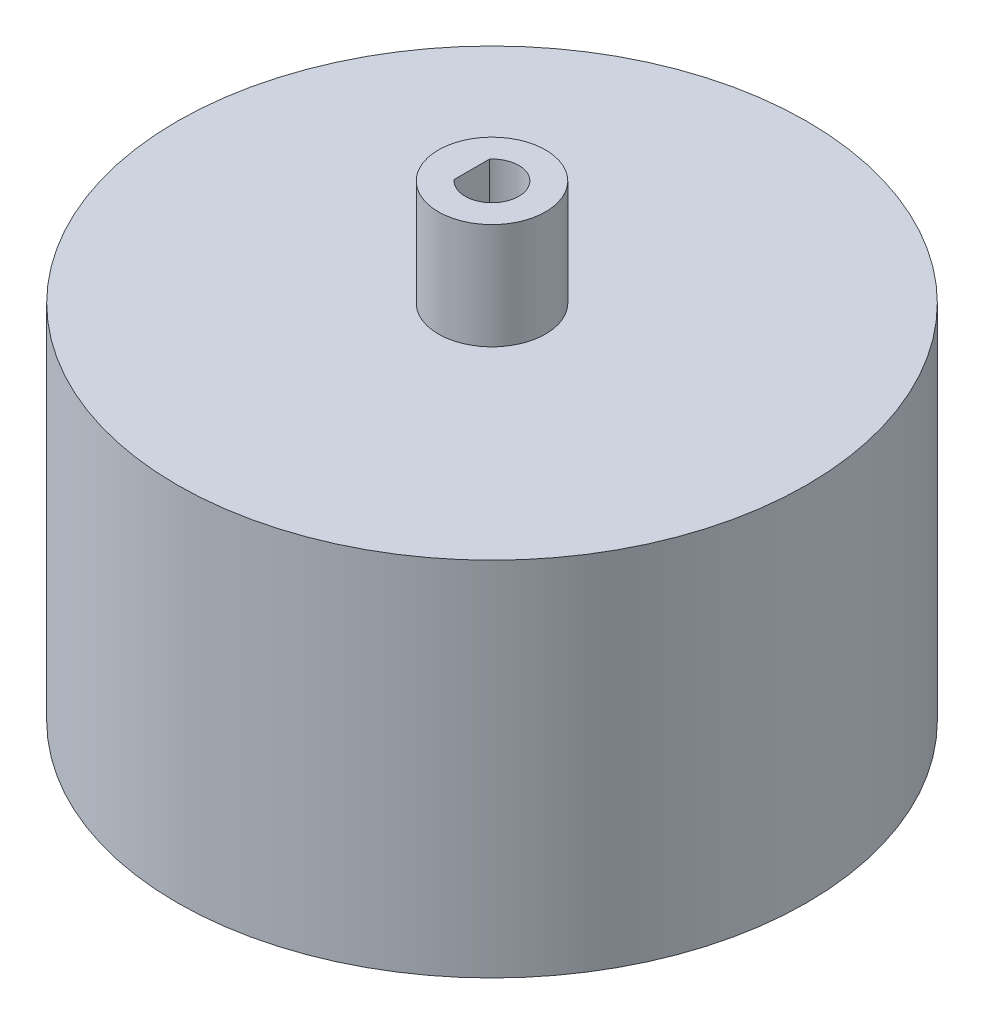
from build123d import *

# Parameters (mm, degrees)
CROQUIS1_R              = 23.5
CROQUIS1_R_2            = 19.5
SALIENTE_EXTRUIR1_DEPTH = 22
CROQUIS2_R              = 23.5
SALIENTE_EXTRUIR2_DEPTH = 5
CROQUIS4_R              = 4
SALIENTE_EXTRUIR3_DEPTH = 7.9
CORTAR_EXTRUIR1_DEPTH   = 49.192426791
ENVOLVER5_DEPTH         = 17


# Read off the part's stored shape, not the designer's step: Envolver5
with BuildPart() as part:
    # Croquis1 → Saliente-Extruir1 (new body)
    with BuildSketch(Plane(origin=(0, 0, 0), x_dir=(1, 0, 0), z_dir=(0, 1, 0))):
        with Locations(Location((0, 0, 0), (0, 0, 270))):
            Circle(CROQUIS1_R)
        with Locations(Location((0, 0, 0), (0, 0, 270))):
            Circle(CROQUIS1_R_2, mode=Mode.SUBTRACT)
    extrude(amount=SALIENTE_EXTRUIR1_DEPTH)

    # Croquis2 → Saliente-Extruir2 (add)
    with BuildSketch(Plane(origin=(0, 22, 0), x_dir=(1, 0, 0), z_dir=(0, 1, 0))):
        with Locations(Location((0, 0, 0), (0, 0, 270))):
            Circle(CROQUIS2_R)
    extrude(amount=SALIENTE_EXTRUIR2_DEPTH)

    # Croquis4 → Saliente-Extruir3 (add)
    with BuildSketch(Plane(origin=(0, 27, 0), x_dir=(1, 0, 0), z_dir=(0, 1, 0))):
        with Locations(Location((0, 0, 0), (0, 0, 270))):
            Circle(CROQUIS4_R)
    extrude(amount=SALIENTE_EXTRUIR3_DEPTH)

    # Croquis5 → Cortar-Extruir1 (cut, through all)
    with BuildSketch(Plane(origin=(0, 34.9, 0), x_dir=(1, 0, 0), z_dir=(0, 1, 0))):
        with BuildLine():
            Line((-1.5, 1.322875656), (-1.5, -1.322875656))
            ThreePointArc((-1.5, -1.322875656), (2, 0), (-1.5, 1.322875656))
        make_face()
    extrude(amount=-CORTAR_EXTRUIR1_DEPTH, mode=Mode.SUBTRACT)

    # Envolver5 outline → Envolver5 (add)
    with BuildSketch(Plane(origin=(0, 0, 0), x_dir=(1, 0, 0), z_dir=(0, 1, 0))):
        with BuildLine():
            ThreePointArc((-18.034428092, -7.416832437), (-17.731299823, -8.114863313), (-17.401166174, -8.800534972))
            Line((-17.401166174, -8.800534972), (-16.508798678, -8.349225486))
            ThreePointArc((-16.508798678, -8.349225486), (-16.822002396, -7.698716476), (-17.109585626, -7.036482056))
            Line((-17.109585626, -7.036482056), (-18.034428092, -7.416832437))
        make_face()
        with BuildLine():
            Line((-16.299247399, -8.751259009), (-17.180287799, -9.224300036))
            ThreePointArc((-17.180287799, -9.224300036), (-16.807285038, -9.887627099), (-16.408684204, -10.535894964))
            Line((-16.408684204, -10.535894964), (-15.567213219, -9.995592659))
            ThreePointArc((-15.567213219, -9.995592659), (-15.945372985, -9.380569299), (-16.299247399, -8.751259009))
        make_face()
        with BuildLine():
            ThreePointArc((-18.699023356, -5.531412617), (-18.55106119, -6.00900397), (-18.390903072, -6.482644847))
            Line((-18.390903072, -6.482644847), (-17.447779837, -6.150201521))
            ThreePointArc((-17.447779837, -6.150201521), (-17.599724719, -5.70084992), (-17.740099081, -5.247750431))
            Line((-17.740099081, -5.247750431), (-18.699023356, -5.531412617))
        make_face()
        with BuildLine():
            Line((-15.317601198, -10.374058682), (-16.145579641, -10.934818611))
            ThreePointArc((-16.145579641, -10.934818611), (-15.706622714, -11.556470175), (-15.24374406, -12.160520837))
            Line((-15.24374406, -12.160520837), (-14.462013596, -11.536904384))
            ThreePointArc((-14.462013596, -11.536904384), (-14.901154883, -10.963830679), (-15.317601198, -10.374058682))
        make_face()
        with BuildLine():
            ThreePointArc((-19.256272079, -3.073432222), (-19.12168694, -3.822445367), (-18.957978812, -4.565636795))
            Line((-18.957978812, -4.565636795), (-17.985774771, -4.331501575))
            ThreePointArc((-17.985774771, -4.331501575), (-18.141087609, -3.626422527), (-18.268770947, -2.915820313))
            Line((-18.268770947, -2.915820313), (-19.256272079, -3.073432222))
        make_face()
        with BuildLine():
            Line((-14.174964299, -11.887825163), (-14.941178586, -12.530410307))
            ThreePointArc((-14.941178586, -12.530410307), (-14.440881008, -13.103852705), (-13.91858947, -13.657337485))
            Line((-13.91858947, -13.657337485), (-13.204815651, -12.956961203))
            ThreePointArc((-13.204815651, -12.956961203), (-13.700323007, -12.431860259), (-14.174964299, -11.887825163))
        make_face()
        with BuildLine():
            ThreePointArc((-19.469750114, -1.085739617), (-19.412559476, -1.844596047), (-19.325802842, -2.600643094))
            Line((-19.325802842, -2.600643094), (-18.33473603, -2.467276781))
            ThreePointArc((-18.33473603, -2.467276781), (-18.417043606, -1.750001378), (-18.47130139, -1.030060662))
            Line((-18.47130139, -1.030060662), (-19.469750114, -1.085739617))
        make_face()
        with BuildLine():
            Line((-12.883346018, -13.276648499), (-13.5797431, -13.994305175))
            ThreePointArc((-13.5797431, -13.994305175), (-13.023363087, -14.513511426), (-12.447148042, -15.010613099))
            Line((-12.447148042, -15.010613099), (-11.808832758, -14.240838068))
            ThreePointArc((-11.808832758, -14.240838068), (-12.355498313, -13.769228789), (-12.883346018, -13.276648499))
        make_face()
        with BuildLine():
            ThreePointArc((-19.47859763, 0.913364304), (-19.499402579, 0.152640304), (-19.490509266, -0.608316173))
            Line((-19.490509266, -0.608316173), (-18.49099597, -0.577120472))
            ThreePointArc((-18.49099597, -0.577120472), (-18.499433216, 0.144812596), (-18.479695188, 0.866525109))
            Line((-18.479695188, 0.866525109), (-19.47859763, 0.913364304))
        make_face()
        with BuildLine():
            Line((-11.456321492, -14.525931911), (-12.075582113, -15.31111742))
            ThreePointArc((-12.075582113, -15.31111742), (-11.468967316, -15.770630574), (-10.844884887, -16.206124515))
            Line((-10.844884887, -16.206124515), (-10.288736944, -15.375041206))
            ThreePointArc((-10.288736944, -15.375041206), (-10.880815146, -14.961880288), (-11.456321492, -14.525931911))
        make_face()
        with BuildLine():
            ThreePointArc((-19.282721641, 2.902868604), (-19.381303511, 2.148272377), (-19.450366989, 1.390404258))
            Line((-19.450366989, 1.390404258), (-18.452912271, 1.319101475))
            ThreePointArc((-18.452912271, 1.319101475), (-18.387390511, 2.038104563), (-18.29386412, 2.754003548))
            Line((-18.29386412, 2.754003548), (-19.282721641, 2.902868604))
        make_face()
        with BuildLine():
            Line((-9.908888999, -15.622545209), (-10.444504621, -16.467007112))
            ThreePointArc((-10.444504621, -16.467007112), (-9.79403067, -16.861997605), (-9.128640073, -17.231306695))
            Line((-9.128640073, -17.231306695), (-8.660504684, -16.347649942))
            ThreePointArc((-8.660504684, -16.347649942), (-9.291772686, -15.997279779), (-9.908888999, -15.622545209))
        make_face()
        with BuildLine():
            ThreePointArc((-18.884180835, 4.861863242), (-19.059503515, 4.121325729), (-19.205797914, 3.374511294))
            Line((-19.205797914, 3.374511294), (-18.220885201, 3.201459433))
            ThreePointArc((-18.220885201, 3.201459433), (-18.082093078, 3.909975691), (-17.915761305, 4.612536922))
            Line((-17.915761305, 4.612536922), (-18.884180835, 4.861863242))
        make_face()
        with BuildLine():
            Line((-8.257312331, -16.554962793), (-8.703653538, -17.449825646))
            ThreePointArc((-8.703653538, -17.449825646), (-8.016157029, -17.776142058), (-7.316451637, -18.075384794))
            Line((-7.316451637, -18.075384794), (-6.941248989, -17.148441984))
            ThreePointArc((-6.941248989, -17.148441984), (-7.605072053, -16.86454503), (-8.257312331, -16.554962793))
        make_face()
        with BuildLine():
            ThreePointArc((-18.287163949, 6.769758837), (-18.537384765, 6.051063217), (-18.759372506, 5.32315162))
            Line((-18.759372506, 5.32315162), (-17.797353403, 5.050169486))
            ThreePointArc((-17.797353403, 5.050169486), (-17.586749649, 5.740752283), (-17.349360669, 6.422591717))
            Line((-17.349360669, 6.422591717), (-18.287163949, 6.769758837))
        make_face()
        with BuildLine():
            Line((-6.51894985, -17.313384789), (-6.871325517, -18.249243426))
            ThreePointArc((-6.871325517, -18.249243426), (-6.15403216, -18.503456114), (-5.427366, -18.729487401))
            Line((-5.427366, -18.729487401), (-5.149039538, -17.769000868))
            ThreePointArc((-5.149039538, -17.769000868), (-5.838440767, -17.554560929), (-6.51894985, -17.313384789))
        make_face()
        with BuildLine():
            ThreePointArc((-17.497945734, 8.606503069), (-17.820434823, 7.917202961), (-18.115782775, 7.215844681))
            Line((-18.115782775, 7.215844681), (-17.186768274, 6.845801364))
            ThreePointArc((-17.186768274, 6.845801364), (-16.90656637, 7.511192553), (-16.600615184, 8.165143938))
            Line((-16.600615184, 8.165143938), (-17.497945734, 8.606503069))
        make_face()
        with BuildLine():
            Line((-4.712072052, -17.889840049), (-4.966778649, -18.85685843))
            ThreePointArc((-4.966778649, -18.85685843), (-4.227227324, -19.036295573), (-3.481237786, -19.186739782))
            Line((-3.481237786, -19.186739782), (-3.302712772, -18.202804409))
            ThreePointArc((-3.302712772, -18.202804409), (-4.010446436, -18.060075287), (-4.712072052, -17.889840049))
        make_face()
        with BuildLine():
            ThreePointArc((-16.524821015, 10.352791432), (-16.916188958, 9.700131502), (-17.281792962, 9.032697937))
            Line((-17.281792962, 9.032697937), (-16.395547169, 8.569482659))
            ThreePointArc((-16.395547169, 8.569482659), (-16.048692088, 9.202688861), (-15.677394296, 9.821879051))
            Line((-15.677394296, 9.821879051), (-16.524821015, 10.352791432))
        make_face()
        with BuildLine():
            Line((-2.855669543, -18.278269925), (-3.010030059, -19.266284516))
            ThreePointArc((-3.010030059, -19.266284516), (-2.255993581, -19.369060198), (-1.498521148, -19.442336135))
            Line((-1.498521148, -19.442336135), (-1.421673909, -18.445293256))
            ThreePointArc((-1.421673909, -18.445293256), (-2.140301603, -18.37577506), (-2.855669543, -18.278269925))
        make_face()
        with BuildLine():
            ThreePointArc((-15.378017503, 11.990270125), (-15.834150954, 11.381109944), (-16.266168448, 10.754615941))
            Line((-16.266168448, 10.754615941), (-15.432005963, 10.203097175))
            ThreePointArc((-15.432005963, 10.203097175), (-15.022143213, 10.79746328), (-14.589401221, 11.375384477))
            Line((-14.589401221, 11.375384477), (-15.378017503, 11.990270125))
        make_face()
        with BuildLine():
            Line((-0.969253443, -18.474591951), (-1.021645521, -19.473218543))
            ThreePointArc((-1.021645521, -19.473218543), (-0.261048947, -19.498252574), (0.499945213, -19.493590095))
            Line((0.499945213, -19.493590095), (0.474306997, -18.493918808))
            ThreePointArc((0.474306997, -18.493918808), (-0.247661822, -18.498342186), (-0.969253443, -18.474591951))
        make_face()
        with BuildLine():
            ThreePointArc((-14.069588308, 13.501728958), (-14.585693224, 12.942470907), (-15.079583626, 12.363501028))
            Line((-15.079583626, 12.363501028), (-14.306271645, 11.729475335))
            ThreePointArc((-14.306271645, 11.729475335), (-13.837708955, 12.278754451), (-13.348070959, 12.809332601))
            Line((-13.348070959, 12.809332601), (-14.069588308, 13.501728958))
        make_face()
        with BuildLine():
            Line((0.927349683, -18.476742748), (0.977476693, -19.475485599))
            ThreePointArc((0.977476693, -19.475485599), (1.736639358, -19.422514866), (2.493157062, -19.339962975))
            Line((2.493157062, -19.339962975), (2.365302853, -18.348170002))
            ThreePointArc((2.365302853, -18.348170002), (1.647580929, -18.426488463), (0.927349683, -18.476742748))
        make_face()
        with BuildLine():
            ThreePointArc((-12.61328525, 14.871282231), (-13.183937276, 14.367804213), (-13.734509712, 13.842443533))
            Line((-13.734509712, 13.842443533), (-13.030175881, 13.132574634))
            ThreePointArc((-13.030175881, 13.132574634), (-12.507837929, 13.63099374), (-11.966450109, 14.108652373))
            Line((-11.966450109, 14.108652373), (-12.61328525, 14.871282231))
        make_face()
        with BuildLine():
            Line((2.814206199, -18.28469971), (2.966325453, -19.273061856))
            ThreePointArc((2.966325453, -19.273061856), (3.716075276, -19.142643092), (4.460165388, -18.983069423))
            Line((4.460165388, -18.983069423), (4.231438958, -18.009578683))
            ThreePointArc((4.231438958, -18.009578683), (3.525507313, -18.160969087), (2.814206199, -18.28469971))
        make_face()
        with BuildLine():
            ThreePointArc((-11.024414333, 16.084535698), (-11.643615817, 15.642129354), (-12.245083672, 15.175899507))
            Line((-12.245083672, 15.175899507), (-11.617130664, 14.397648251))
            ThreePointArc((-11.617130664, 14.397648251), (-11.046507313, 14.839968874), (-10.459059752, 15.259687713))
            Line((-10.459059752, 15.259687713), (-11.024414333, 16.084535698))
        make_face()
        with BuildLine():
            Line((4.671484911, -17.900481243), (4.923997609, -18.868074824))
            ThreePointArc((4.923997609, -18.868074824), (5.656454586, -18.661578752), (6.380296588, -18.426660453))
            Line((6.380296588, -18.426660453), (6.053101891, -17.481703507))
            ThreePointArc((6.053101891, -17.481703507), (5.366379992, -17.704574714), (4.671484911, -17.900481243))
        make_face()
        with BuildLine():
            ThreePointArc((-9.319674872, 17.128737849), (-9.980917895, 16.752052948), (-10.626959637, 16.349854093))
            Line((-10.626959637, 16.349854093), (-10.081987348, 15.511400037))
            ThreePointArc((-10.081987348, 15.511400037), (-9.469075952, 15.89297331), (-8.841742827, 16.250341036))
            Line((-8.841742827, 16.250341036), (-9.319674872, 17.128737849))
        make_face()
        with BuildLine():
            Line((6.479665489, -17.328125552), (6.829917678, -18.264780987))
            ThreePointArc((6.829917678, -18.264780987), (7.537383557, -17.984377919), (8.233369741, -17.676584023))
            Line((8.233369741, -17.676584023), (7.811145652, -16.770092534))
            ThreePointArc((7.811145652, -16.770092534), (7.150851067, -17.062102128), (6.479665489, -17.328125552))
        make_face()
        with BuildLine():
            ThreePointArc((-7.516983978, 17.992913935), (-8.213318761, 17.685909503), (-8.897144376, 17.351968821))
            Line((-8.897144376, 17.351968821), (-8.440880562, 16.462124266))
            ThreePointArc((-8.440880562, 16.462124266), (-7.792122927, 16.778939784), (-7.13149762, 17.0702004))
            Line((-7.13149762, 17.0702004), (-7.516983978, 17.992913935))
        make_face()
        with BuildLine():
            Line((8.219743638, -16.573648196), (8.664054105, -17.469521072))
            ThreePointArc((8.664054105, -17.469521072), (9.339093294, -17.118158092), (9.999908722, -16.740723567))
            Line((9.999908722, -16.740723567), (9.48709289, -15.882224923))
            ThreePointArc((9.48709289, -15.882224923), (8.860165432, -16.24030383), (8.219743638, -16.573648196))
        make_face()
        with BuildLine():
            ThreePointArc((-5.635288254, 18.667981313), (-6.359396194, 18.43388402), (-7.073818554, 18.171711286))
            Line((-7.073818554, 18.171711286), (-6.711058628, 17.239828656))
            ThreePointArc((-6.711058628, 17.239828656), (-6.033273312, 17.488556634), (-5.346299113, 17.710648938))
            Line((-5.346299113, 17.710648938), (-5.635288254, 18.667981313))
        make_face()
        with BuildLine():
            Line((9.873430826, -15.644978866), (10.40712979, -16.490653399))
            ThreePointArc((10.40712979, -16.490653399), (11.042647508, -16.072023395), (11.661346894, -15.628915145))
            Line((11.661346894, -15.628915145), (11.063329104, -14.827432317))
            ThreePointArc((11.063329104, -14.827432317), (10.476357892, -15.247817067), (9.873430826, -15.644978866))
        make_face()
        with BuildLine():
            ThreePointArc((-3.694364653, 19.146844905), (-4.438635247, 18.988115155), (-5.176145647, 18.800465852))
            Line((-5.176145647, 18.800465852), (-4.91070228, 17.836339398))
            ThreePointArc((-4.91070228, 17.836339398), (-4.211012926, 18.01436566), (-3.504910055, 18.164955423))
            Line((-3.504910055, 18.164955423), (-3.694364653, 19.146844905))
        make_face()
        with BuildLine():
            Line((11.42334651, -14.551878041), (12.0408247, -15.338466043))
            ThreePointArc((12.0408247, -15.338466043), (12.630141544, -14.85696889), (13.200222247, -14.352844061))
            Line((13.200222247, -14.352844061), (12.523287773, -13.616800776))
            ThreePointArc((12.523287773, -13.616800776), (11.982441977, -14.095073049), (11.42334651, -14.551878041))
        make_face()
        with BuildLine():
            ThreePointArc((-1.714612626, 19.42447177), (-2.471223459, 19.342777841), (-3.224070534, 19.231624195))
            Line((-3.224070534, 19.231624195), (-3.058733583, 18.245387057))
            ThreePointArc((-3.058733583, 18.245387057), (-2.344494051, 18.350840516), (-1.626683773, 18.428345013))
            Line((-1.626683773, 18.428345013), (-1.714612626, 19.42447177))
        make_face()
        with BuildLine():
            Line((12.853200802, -13.305834403), (13.547968413, -14.025068695))
            ThreePointArc((13.547968413, -14.025068695), (14.084890558, -13.485765013), (14.600360929, -12.925922046))
            Line((14.600360929, -12.925922046), (13.851624471, -12.263054249))
            ThreePointArc((13.851624471, -12.263054249), (13.362588478, -12.79418732), (12.853200802, -13.305834403))
        make_face()
        with BuildLine():
            ThreePointArc((0.283160283, 19.497944001), (-0.477838675, 19.494144511), (-1.238109869, 19.460654767))
            Line((-1.238109869, 19.460654767), (-1.174617055, 18.462672471))
            ThreePointArc((-1.174617055, 18.462672471), (-0.453334128, 18.494444792), (0.268639243, 18.498049437))
            Line((0.268639243, 18.498049437), (0.283160283, 19.497944001))
        make_face()
        with BuildLine():
            Line((14.147965679, -11.919944091), (14.912720581, -12.564265394))
            ThreePointArc((14.912720581, -12.564265394), (15.39160488, -11.97282336), (15.847047235, -11.363146305))
            Line((15.847047235, -11.363146305), (15.034378146, -10.780420853))
            ThreePointArc((15.034378146, -10.780420853), (14.602291809, -11.358832419), (14.147965679, -11.919944091))
        make_face()
        with BuildLine():
            ThreePointArc((2.277957127, 19.366489391), (1.520568277, 19.440624273), (0.760863549, 19.485150414))
            Line((0.760863549, 19.485150414), (0.721844906, 18.485911931))
            ThreePointArc((0.721844906, 18.485911931), (1.442590417, 18.443669182), (2.161138813, 18.373336089))
            Line((2.161138813, 18.373336089), (2.277957127, 19.366489391))
        make_face()
        with BuildLine():
            Line((15.294032934, -10.408773059), (16.120737417, -10.971409441))
            ThreePointArc((16.120737417, -10.971409441), (16.536550712, -10.334045217), (16.927178271, -9.680941885))
            Line((16.927178271, -9.680941885), (16.059117847, -9.184483327))
            ThreePointArc((16.059117847, -9.184483327), (15.688522471, -9.80409418), (15.294032934, -10.408773059))
        make_face()
        with BuildLine():
            ThreePointArc((4.248812239, 19.031489552), (3.502993788, 19.182779635), (2.751840157, 19.304853684))
            Line((2.751840157, 19.304853684), (2.610720149, 18.314861187))
            ThreePointArc((2.610720149, 18.314861187), (3.323353081, 18.199047346), (4.030924432, 18.055515729))
            Line((4.030924432, 18.055515729), (4.248812239, 19.031489552))
        make_face()
        with BuildLine():
            Line((16.279357198, -8.788203981), (17.159322452, -9.263242034))
            ThreePointArc((17.159322452, -9.263242034), (17.507694472, -8.586654429), (17.829401669, -7.896989054))
            Line((17.829401669, -7.896989054), (16.915073378, -7.492015256))
            ThreePointArc((16.915073378, -7.492015256), (16.609863986, -8.146313177), (16.279357198, -8.788203981))
        make_face()
        with BuildLine():
            ThreePointArc((6.175011583, 18.496465391), (5.448602215, 18.72332059), (4.713894438, 18.921659526))
            Line((4.713894438, 18.921659526), (4.472156262, 17.951318012))
            ThreePointArc((4.472156262, 17.951318012), (5.169186717, 17.763150303), (5.858344322, 17.547928704))
            Line((5.858344322, 17.547928704), (6.175011583, 18.496465391))
        make_face()
        with BuildLine():
            Line((17.093582538, -7.075269324), (18.017559973, -7.457716315))
            ThreePointArc((18.017559973, -7.457716315), (18.294829265, -6.749016385), (18.544234902, -6.030037471))
            Line((18.544234902, -6.030037471), (17.593248497, -5.72080478))
            ThreePointArc((17.593248497, -5.72080478), (17.356632892, -6.40291298), (17.093582538, -7.075269324))
        make_face()
        with BuildLine():
            ThreePointArc((8.036310462, 17.767040107), (7.336944868, 18.067076133), (6.626404855, 18.33959538))
            Line((6.626404855, 18.33959538), (6.286589221, 17.399103309))
            ThreePointArc((6.286589221, 17.399103309), (6.960691285, 17.140559408), (7.624191977, 16.855909845))
            Line((7.624191977, 16.855909845), (8.036310462, 17.767040107))
        make_face()
        with BuildLine():
            Line((17.728151302, -5.287972336), (18.686429751, -5.573808678))
            ThreePointArc((18.686429751, -5.573808678), (18.889682166, -4.840444985), (19.064164946, -4.099709127))
            Line((19.064164946, -4.099709127), (18.086515461, -3.889467634))
            ThreePointArc((18.086515461, -3.889467634), (17.920980517, -4.592217037), (17.728151302, -5.287972336))
        make_face()
        with BuildLine():
            ThreePointArc((9.813146297, 16.850880088), (9.148174933, 17.22094351), (8.469270584, 17.564778842))
            Line((8.469270584, 17.564778842), (8.034949016, 16.664020953))
            ThreePointArc((8.034949016, 16.664020953), (8.679037758, 16.337818202), (9.309908026, 15.986732391))
            Line((9.309908026, 15.986732391), (9.813146297, 16.850880088))
        make_face()
        with BuildLine():
            Line((18.176394059, -3.445097822), (19.158901846, -3.631319326))
            ThreePointArc((19.158901846, -3.631319326), (19.286001167, -2.880999652), (19.383727243, -2.126292116))
            Line((19.383727243, -2.126292116), (18.389689949, -2.017251494))
            ThreePointArc((18.389689949, -2.017251494), (18.296975466, -2.73325608), (18.176394059, -3.445097822))
        make_face()
        with BuildLine():
            ThreePointArc((11.486844229, 15.757614339), (10.863256062, 16.193815725), (10.223122782, 16.605353371))
            Line((10.223122782, 16.605353371), (9.698860075, 15.753796788))
            ThreePointArc((9.698860075, 15.753796788), (10.306166007, 15.363363636), (10.897775294, 14.949531553))
            Line((10.897775294, 14.949531553), (11.486844229, 15.757614339))
        make_face()
        with BuildLine():
            Line((18.4335997, -1.566014721), (19.430010494, -1.650664165))
            ThreePointArc((19.430010494, -1.650664165), (19.479620883, -0.891274502), (19.499563139, -0.130527398))
            Line((19.499563139, -0.130527398), (18.499585542, -0.123833685))
            ThreePointArc((18.499585542, -0.123833685), (18.480665966, -0.845568118), (18.4335997, -1.566014721))
        make_face()
        with BuildLine():
            ThreePointArc((13.039813396, 14.498733276), (12.464162447, 14.996488072), (11.86952815, 15.471402699))
            Line((11.86952815, 15.471402699), (11.260834399, 14.677997433))
            ThreePointArc((11.260834399, 14.677997433), (11.824974629, 14.227437402), (12.371105016, 13.755208493))
            Line((12.371105016, 13.755208493), (13.039813396, 14.498733276))
        make_face()
        with BuildLine():
            ThreePointArc((14.455731817, 13.087467961), (13.934068281, 13.641544676), (13.391182679, 14.174844848))
            Line((13.391182679, 14.174844848), (12.704455362, 13.447929728))
            ThreePointArc((12.704455362, 13.447929728), (13.219500677, 12.941978282), (13.714412237, 12.416315758))
            Line((13.714412237, 12.416315758), (14.455731817, 13.087467961))
        make_face()
        with BuildLine():
            Line((18.497064947, 0.329527472), (19.496906295, 0.347339768))
            ThreePointArc((19.496906295, 0.347339768), (19.468506339, 1.1078181), (19.410455176, 1.866609186))
            Line((19.410455176, 1.866609186), (18.415047218, 1.770885638))
            ThreePointArc((18.415047218, 1.770885638), (18.470121398, 1.051006915), (18.497064947, 0.329527472))
        make_face()
        with BuildLine():
            ThreePointArc((15.71971794, 11.538651043), (15.257524592, 12.143226232), (14.772093508, 12.72930687))
            Line((14.772093508, 12.72930687), (14.014550251, 12.076521903))
            ThreePointArc((14.014550251, 12.076521903), (14.475087433, 11.520496682), (14.913578558, 10.946925349))
            Line((14.913578558, 10.946925349), (15.71971794, 11.538651043))
        make_face()
        with BuildLine():
            Line((18.366122769, 2.221606273), (19.358886162, 2.341693098))
            ThreePointArc((19.358886162, 2.341693098), (19.252774348, 3.095267337), (19.117339896, 3.844127378))
            Line((19.117339896, 3.844127378), (18.136963491, 3.64699264))
            ThreePointArc((18.136963491, 3.64699264), (18.265452587, 2.936535679), (18.366122769, 2.221606273))
        make_face()
        with BuildLine():
            ThreePointArc((16.818487046, 9.868560862), (16.42062162, 10.517280334), (15.997747021, 11.149981625))
            Line((15.997747021, 11.149981625), (15.177349738, 10.578187696))
            ThreePointArc((15.177349738, 10.578187696), (15.57853846, 9.977932624), (15.956000531, 9.362480817))
            Line((15.956000531, 9.362480817), (16.818487046, 9.868560862))
        make_face()
        with BuildLine():
            Line((18.042149392, 4.090335599), (19.017400711, 4.31143482))
            ThreePointArc((19.017400711, 4.31143482), (18.834692294, 5.050184768), (18.623297992, 5.78124311))
            Line((18.623297992, 5.78124311), (17.668257069, 5.484769104))
            ThreePointArc((17.668257069, 5.484769104), (17.868810638, 4.791200934), (18.042149392, 4.090335599))
        make_face()
        with BuildLine():
            ThreePointArc((17.740490879, 8.09475036), (17.41113501, 8.780795958), (17.055261384, 9.453468101))
            Line((17.055261384, 9.453468101), (16.180632595, 8.968674865))
            ThreePointArc((16.180632595, 8.968674865), (16.518256292, 8.330498729), (16.830722116, 7.679634956))
            Line((16.830722116, 7.679634956), (17.740490879, 8.09475036))
        make_face()
        with BuildLine():
            Line((17.528549834, 5.916074774), (18.476039014, 6.235862599))
            ThreePointArc((18.476039014, 6.235862599), (18.218654292, 6.952023863), (17.933521932, 7.657596955))
            Line((17.933521932, 7.657596955), (17.01385414, 7.264899675))
            ThreePointArc((17.01385414, 7.264899675), (17.284364328, 6.595509819), (17.528549834, 5.916074774))
        make_face()
    extrude(amount=ENVOLVER5_DEPTH)


solid = part.part
